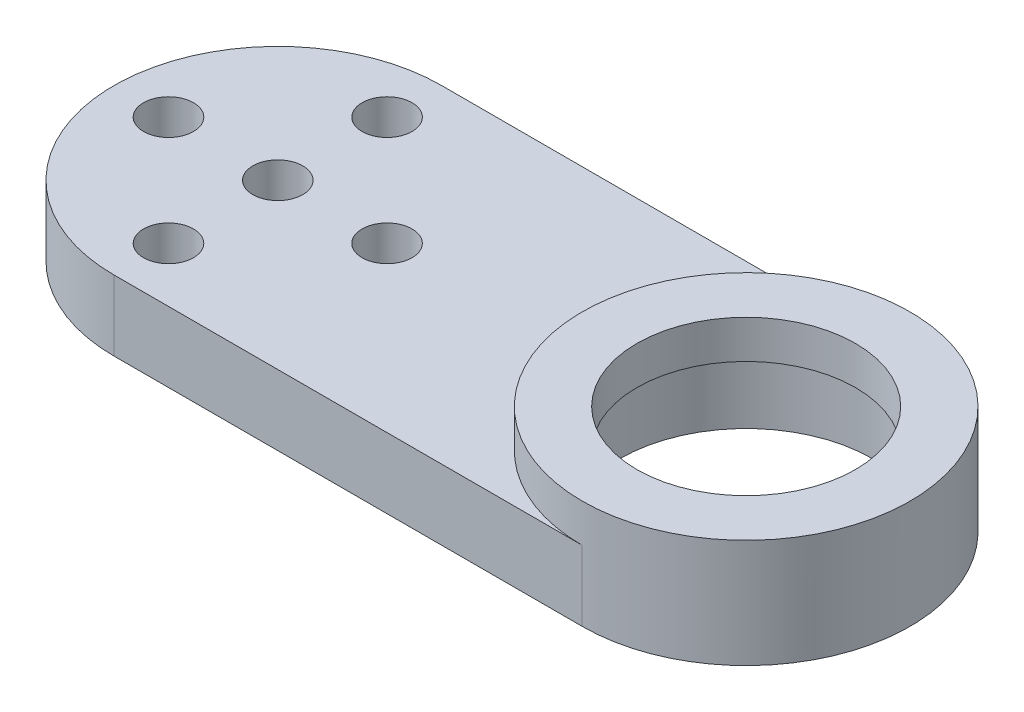
from build123d import *

# Parameters (mm, degrees)
BOSS_EXTRUDE1_DEPTH     = 4.5
SKETCH4_R               = 1.6
SERVO_HORN_HOLES_DEPTH  = 28.941904015
SKETCH5_R               = 8.1
BEARING_PRESS_FIT_DEPTH = 28.941904015
SKETCH6_R               = 10.5
SKETCH6_R_2             = 7
BOSS_EXTRUDE2_DEPTH     = 2.45


with BuildPart() as part:
    # Sketch2 → Boss-Extrude1 (new body)
    with BuildSketch(Plane(origin=(0, 0, 0), x_dir=(1, 0, 0), z_dir=(0, 1, 0))):
        with BuildLine():
            Line((15, 10.5), (-15, 10.5))
            ThreePointArc((-15, 10.5), (-25.5, 0), (-15, -10.5))
            Line((-15, -10.5), (15, -10.5))
            ThreePointArc((15, -10.5), (25.5, 0), (15, 10.5))
        make_face()
    extrude(amount=BOSS_EXTRUDE1_DEPTH)

    # Sketch4 → Servo horn holes (cut, through all)
    with BuildSketch(Plane(origin=(0, 4.5, 0), x_dir=(1, 0, 0), z_dir=(0, 1, 0))):
        with Locations((-15, 0)):
            Circle(SKETCH4_R)
        with Locations((-8, 0)):
            Circle(SKETCH4_R)
        with Locations((-15, -7)):
            Circle(SKETCH4_R)
        with Locations((-22, 0)):
            Circle(SKETCH4_R)
        with Locations((-15, 7)):
            Circle(SKETCH4_R)
    extrude(amount=-SERVO_HORN_HOLES_DEPTH, mode=Mode.SUBTRACT)

    # Sketch5 → Bearing press fit (cut, through all)
    with BuildSketch(Plane(origin=(0, 0, 0), x_dir=(-1, 0, 0), z_dir=(0, -1, 0))):
        with Locations((-15, 0)):
            Circle(SKETCH5_R)
    extrude(amount=-BEARING_PRESS_FIT_DEPTH, mode=Mode.SUBTRACT)

    # Sketch6 → Boss-Extrude2 (add)
    with BuildSketch(Plane(origin=(0, 4.5, 0), x_dir=(1, 0, 0), z_dir=(0, 1, 0))):
        with Locations((15, 0)):
            Circle(SKETCH6_R)
        with Locations((15, 0)):
            Circle(SKETCH6_R_2, mode=Mode.SUBTRACT)
    extrude(amount=BOSS_EXTRUDE2_DEPTH)


solid = part.part
